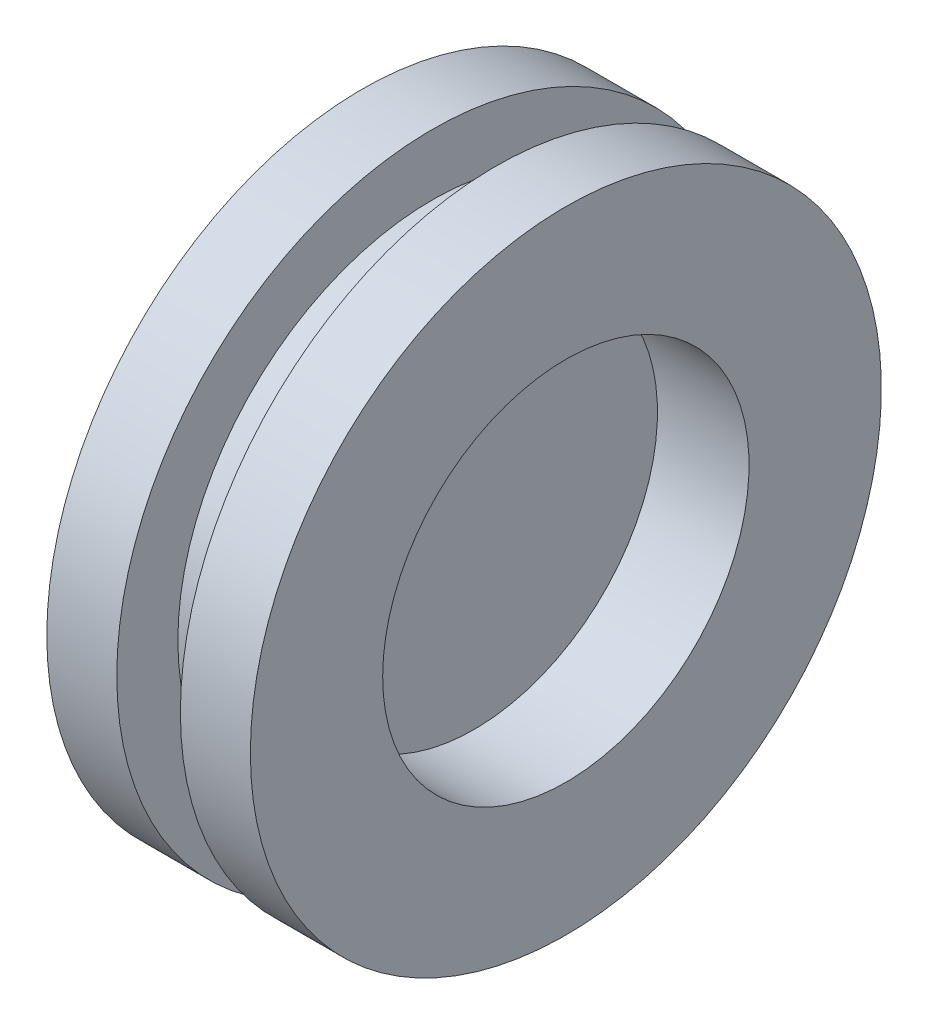
from build123d import *


with BuildPart() as part:
    # Sketch1 → Revolve1 (revolve)
    with BuildSketch(Plane.XY):
        Polygon((-0.254, 0), (0.254, 0), (0.254, 4.572), (2.54, 4.572), (2.54, 7.874), (0.79375, 7.874), (0.79375, 6.35), (-0.79375, 6.35), (-0.79375, 7.874), (-2.54, 7.874), (-2.54, 4.572), (-0.254, 4.572), align=None)
    revolve(axis=Axis((-3.81, 0, 0), (1, 0, 0)))


solid = part.part
